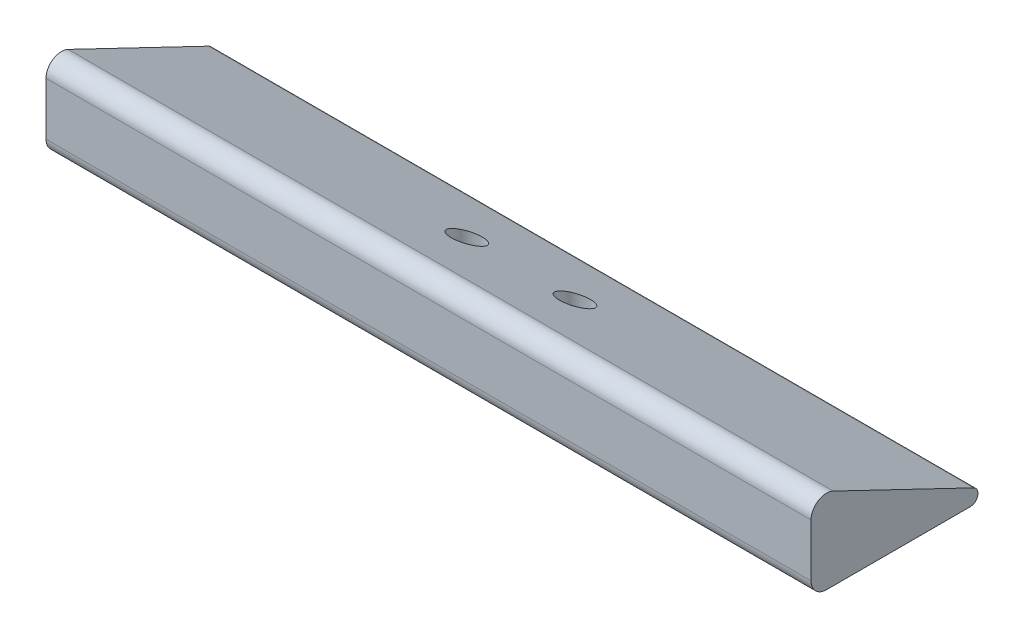
from build123d import *

# Parameters (mm, degrees)
BOSS_EXTRUDE1_DEPTH = 99
SKETCH2_R           = 2
CUT_EXTRUDE1_DEPTH  = 8
SKETCH3_R           = 1.5
CUT_EXTRUDE2_DEPTH  = 102.713462255


with BuildPart() as part:
    # Sketch1 → Boss-Extrude1 (new body)
    with BuildSketch(Plane(origin=(0, 0, 0), x_dir=(0, 0, -1), z_dir=(1, 0, 0))):
        with BuildLine():
            Line((2, 0), (20.605762563, 0))
            ThreePointArc((20.605762563, 0), (21.580832575, 0.778102566), (21.03849363, 1.901523057))
            Line((21.03849363, 1.901523057), (2.865462135, 10.624578175))
            ThreePointArc((2.865462135, 10.624578175), (0.934853125, 10.514299657), (0, 8.82153206))
            Line((0, 8.82153206), (0, 2))
            ThreePointArc((0, 2), (0.585786438, 0.585786438), (2, 0))
        make_face()
    extrude(amount=BOSS_EXTRUDE1_DEPTH)

    # Sketch2 → Cut-Extrude1 (cut)
    with BuildSketch(Plane(origin=(0, 10, 0), x_dir=(1, 0, 0), z_dir=(0, 1, 0))):
        with Locations((42.5, 11.951977883)):
            Circle(SKETCH2_R)
        with Locations((56.5, 11.951977883)):
            Circle(SKETCH2_R)
    extrude(amount=-CUT_EXTRUDE1_DEPTH, mode=Mode.SUBTRACT)

    # Sketch3 → Cut-Extrude2 (cut, through all)
    with BuildSketch(Plane(origin=(0, 2, 0), x_dir=(1, 0, 0), z_dir=(0, 1, 0))):
        with Locations((42.5, 11.951977883)):
            Circle(SKETCH3_R)
        with Locations((56.5, 11.951977883)):
            Circle(SKETCH3_R)
    extrude(amount=-CUT_EXTRUDE2_DEPTH, mode=Mode.SUBTRACT)


solid = part.part
